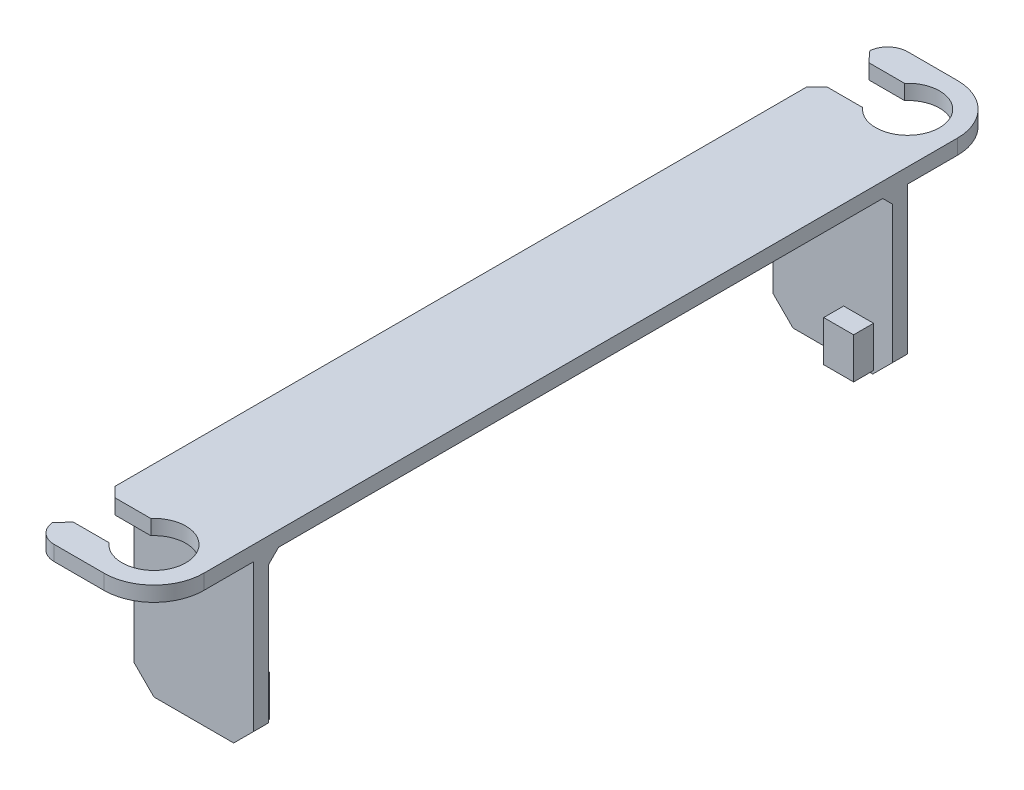
from build123d import *

# Parameters (mm, degrees)
BOSS_EXTRUDE1_DEPTH = 12
CUT_EXTRUDE1_DEPTH  = 60.533114979
FILLET1_R           = 5
FILLET2_R           = 2
CHAMFER1_START      = 29
CHAMFER1_DEPTH      = 4
CHAMFER2_SIZE       = 2
SKETCH3_W           = 3
SKETCH3_H           = 4.1
BOSS_EXTRUDE2_DEPTH = 2
SKETCH4_W           = 3
SKETCH4_H           = 4.1
BOSS_EXTRUDE3_DEPTH = 2


with BuildPart() as part:
    # Sketch1 → Boss-Extrude1 (new body)
    with BuildSketch(Plane(origin=(0, 0, 0), x_dir=(0, 0, -1), z_dir=(1, 0, 0))):
        Polygon((-43.352838341, 30.002180144), (17.247161659, 30.002180144), (18.247161659, 29.002180144), (18.247161659, 13.2495019), (19.747161659, 13.2495019), (19.747161659, 30.002180144), (29.747161659, 30.002180144), (29.747161659, 31.502180144), (17.868482003, 31.502180144), (-43.974158684, 31.502180144), (-55.852838341, 31.502180144), (-55.852838341, 30.002180144), (-45.852838341, 30.002180144), (-45.852838341, 13.2495019), (-44.352838341, 13.2495019), (-44.352838341, 29.002180144), align=None)
    extrude(amount=BOSS_EXTRUDE1_DEPTH)

    # Sketch2 → Cut-Extrude1 (cut, through all)
    with BuildSketch(Plane.XZ.offset(-30.002180144)):
        with BuildLine():
            ThreePointArc((4.585460706, 48.752838341), (10.2, 50.852838341), (4.585460706, 52.952838341))
            Line((4.585460706, 52.952838341), (0, 52.952838341))
            Line((0, 52.952838341), (0, 48.752838341))
            Line((0, 48.752838341), (4.585460706, 48.752838341))
        make_face()
        with BuildLine():
            ThreePointArc((4.585460706, -22.647161659), (10.2, -24.747161659), (4.585460706, -26.847161659))
            Line((4.585460706, -26.847161659), (0, -26.847161659))
            Line((0, -26.847161659), (0, -22.647161659))
            Line((0, -22.647161659), (4.585460706, -22.647161659))
        make_face()
    extrude(amount=-CUT_EXTRUDE1_DEPTH, mode=Mode.SUBTRACT)

    # Fillet1
    fillet1_edges = [part.edges().sort_by_distance(p)[0] for p in [
        (12, 30.752180144, -29.747161659),
        (12, 30.752180144, 55.852838341),
    ]]
    fillet(fillet1_edges, radius=FILLET1_R)

    # Fillet2
    fillet2_edges = [part.edges().sort_by_distance(p)[0] for p in [
        (0, 30.752180144, 55.852838341),
        (0, 30.752180144, -29.747161659),
    ]]
    fillet(fillet2_edges, radius=FILLET2_R)

    # Chamfer1: read off the stored shape, not the designer's step
    # Chamfer1 outline → Chamfer1 (cut)
    with BuildSketch(Plane(origin=(0, 0, 0), x_dir=(1, 0, 0), z_dir=(0, 1, 0)).offset(CHAMFER1_START)):
        with BuildLine():
            Line((1.005012563, 26.847161659), (0.010025126, 27.947161659))
            ThreePointArc((0.010025126, 27.947161659), (0.002507854, 27.847287209), (0, 27.747161659))
            Line((0, 27.747161659), (0, 26.847161659))
            Line((0, 26.847161659), (1.005012563, 26.847161659))
        make_face()
        Polygon((0, 22.647161659), (0, 21.647161659), (1, 22.647161659), align=None)
        Polygon((1, -48.752838341), (0, -47.752838341), (0, -48.752838341), align=None)
        with BuildLine():
            ThreePointArc((0, -53.852838341), (0.002507854, -53.952963891), (0.010025126, -54.052838341))
            Line((0.010025126, -54.052838341), (1.005012563, -52.952838341))
            Line((1.005012563, -52.952838341), (0, -52.952838341))
            Line((0, -52.952838341), (0, -53.852838341))
        make_face()
    extrude(amount=CHAMFER1_DEPTH, mode=Mode.SUBTRACT)

    # Chamfer2
    chamfer2_edges = [part.edges().sort_by_distance(p)[0] for p in [
        (0, 13.2495019, 45.102838341),
        (12, 13.2495019, -18.997161659),
        (0, 13.2495019, -18.997161659),
        (12, 13.2495019, 45.102838341),
    ]]
    chamfer(chamfer2_edges, length=CHAMFER2_SIZE)

    # Sketch3 → Boss-Extrude2 (add)
    with BuildSketch(Plane(origin=(0, 0, 44.352838341), x_dir=(-1, 0, 0), z_dir=(0, 0, -1))):
        with Locations((-8.580589258, 15.652180144)):
            Rectangle(SKETCH3_W, SKETCH3_H)
    extrude(amount=BOSS_EXTRUDE2_DEPTH)

    # Sketch4 → Boss-Extrude3 (add)
    with BuildSketch(Plane.XY.offset(-18.247161659)):
        with Locations((8.580589258, 15.652180144)):
            Rectangle(SKETCH4_W, SKETCH4_H)
    extrude(amount=BOSS_EXTRUDE3_DEPTH)


solid = part.part
